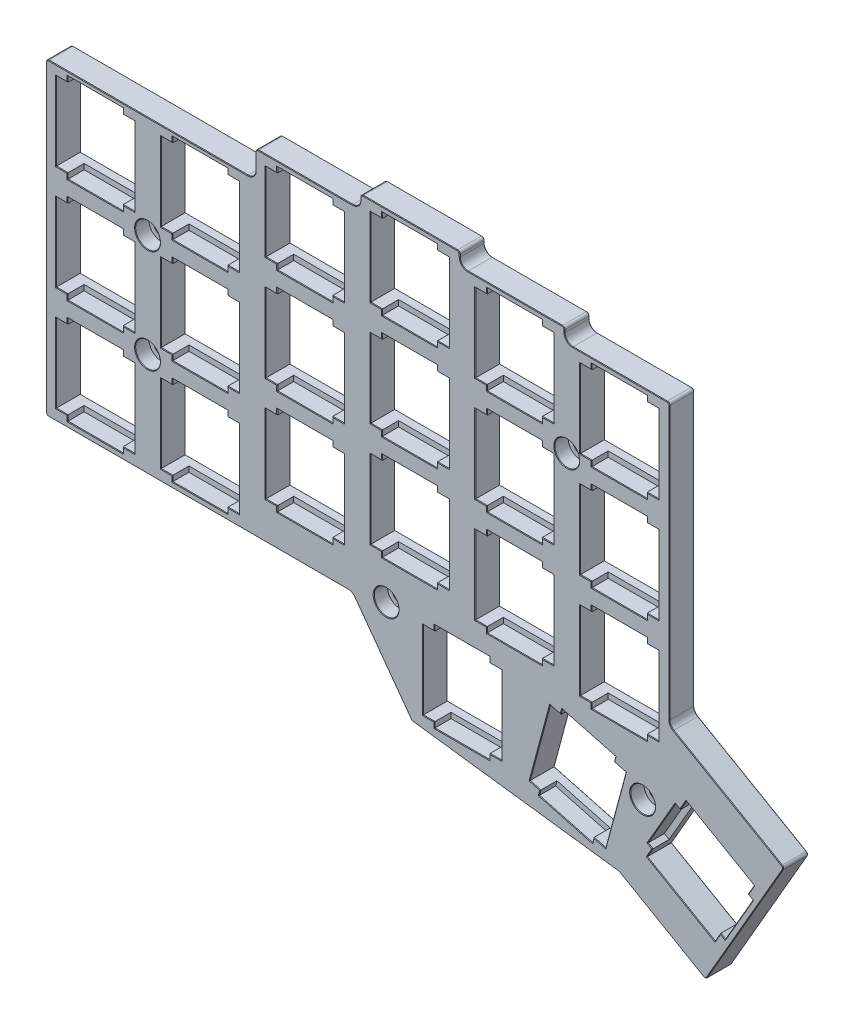
from build123d import *

# Parameters (mm, degrees)
SKETCH2_R           = 1.375
BOSS_EXTRUDE1_DEPTH = 4.5
SKETCH3_R           = 2.25
CUT_EXTRUDE1_DEPTH  = 2.5
SKETCH2_4_W         = 10
SKETCH2_4_H         = 1
BOSS_EXTRUDE2_DEPTH = 1.5
CHAMFER1_SIZE       = 0.1


with BuildPart() as part:
    # Sketch2 → Boss-Extrude1 (new body)
    with BuildSketch(Plane.XY):
        with BuildLine():
            ThreePointArc((40.99248066, 92.247445278), (40.564234363, 91.213567258), (39.530356344, 90.785320961))
            Line((39.530356344, 90.785320961), (3.456164679, 90.785320961))
            ThreePointArc((3.456164679, 90.785320961), (3.129393441, 90.649967882), (2.994040363, 90.323196644))
            Line((2.994040363, 90.323196644), (2.994040363, 35.296142343))
            ThreePointArc((2.994040363, 35.296142343), (3.129393441, 34.969371105), (3.456164679, 34.834018026))
            Line((3.456164679, 34.834018026), (57.719595004, 34.834018026))
            ThreePointArc((57.719595004, 34.834018026), (58.382224343, 34.675247029), (58.900944824, 34.233415689))
            Line((58.900944824, 34.233415689), (69.174535582, 20.145899766))
            ThreePointArc((69.174535582, 20.145899766), (69.312297099, 20.020650552), (69.488305284, 19.959932185))
            Line((69.488305284, 19.959932185), (106.584056872, 15.134426783))
            ThreePointArc((106.584056872, 15.134426783), (106.86436497, 15.069410172), (107.126511412, 14.950755076))
            Line((107.126511412, 14.950755076), (122.178649221, 6.26039926))
            ThreePointArc((122.178649221, 6.26039926), (122.529317954, 6.214232846), (122.809922777, 6.4295485))
            Line((122.809922777, 6.4295485), (136.547798459, 30.224247168))
            ThreePointArc((136.547798459, 30.224247168), (136.593964874, 30.574915901), (136.37864922, 30.855520725))
            Line((136.37864922, 30.855520725), (116.728462948, 42.200561058))
            ThreePointArc((116.728462948, 42.200561058), (116.193288305, 42.735735701), (115.99740079, 43.466797859))
            Line((115.99740079, 43.466797859), (115.99740079, 92.828345033))
            ThreePointArc((115.99740079, 92.828345033), (115.862047712, 93.155116271), (115.535276474, 93.290469349))
            Line((115.535276474, 93.290469349), (98.457766482, 93.290469349))
            ThreePointArc((98.457766482, 93.290469349), (97.423888462, 93.718715647), (96.995642165, 94.752593666))
            Line((96.995642165, 94.752593666), (96.995642165, 95.213192117))
            ThreePointArc((96.995642165, 95.213192117), (96.860289087, 95.539963355), (96.533517849, 95.675316434))
            Line((96.533517849, 95.675316434), (79.456541469, 95.675316434))
            ThreePointArc((79.456541469, 95.675316434), (78.42266345, 96.103562731), (77.994417152, 97.137440751))
            Line((77.994417152, 97.137440751), (77.994417152, 97.587767164))
            ThreePointArc((77.994417152, 97.587767164), (77.859064074, 97.914538402), (77.532292836, 98.049891481))
            Line((77.532292836, 98.049891481), (60.456541472, 98.049891481))
            ThreePointArc((60.456541472, 98.049891481), (60.129770234, 97.914538402), (59.994417156, 97.587767164))
            Line((59.994417156, 97.587767164), (59.994417156, 97.133171852))
            ThreePointArc((59.994417156, 97.133171852), (59.566170859, 96.099293832), (58.532292839, 95.671047535))
            Line((58.532292839, 95.671047535), (41.454604977, 95.671047535))
            ThreePointArc((41.454604977, 95.671047535), (41.127833739, 95.535694456), (40.99248066, 95.208923218))
            Line((40.99248066, 95.208923218), (40.99248066, 92.247445278))
        make_face()
        Polygon((6.896591633, 51.025568854), (6.896591633, 52.025568854), (16.896591633, 52.025568854), (16.896591633, 51.025568854), (18.996591632, 51.025568854), (18.996591632, 36.825568858), (16.896591633, 36.825568858), (16.896591633, 35.825568858), (6.896591633, 35.825568858), (6.896591633, 36.825568858), (4.796591635, 36.825568858), (4.796591635, 51.025568854), align=None, mode=Mode.SUBTRACT)
        Polygon((25.894762974, 51.026240306), (25.894762974, 52.026240306), (35.894762974, 52.026240306), (35.894762974, 51.026240306), (37.994762972, 51.026240306), (37.994762972, 36.82624031), (35.894762974, 36.82624031), (35.894762974, 35.82624031), (25.894762974, 35.82624031), (25.894762974, 36.82624031), (23.794762976, 36.82624031), (23.794762976, 51.026240306), align=None, mode=Mode.SUBTRACT)
        with Locations((64.637863533, 36.300090173)):
            Circle(SKETCH2_R, mode=Mode.SUBTRACT)
        Polygon((54.895031931, 40.571054802), (44.895031931, 40.571054802), (44.895031931, 41.571054802), (42.795031933, 41.571054802), (42.795031933, 55.771054799), (44.895031931, 55.771054799), (44.895031931, 56.771054799), (54.895031931, 56.771054799), (54.895031931, 55.771054799), (56.995031929, 55.771054799), (56.995031929, 41.571054802), (54.895031931, 41.571054802), align=None, mode=Mode.SUBTRACT)
        Polygon((63.896968427, 58.149898744), (63.896968427, 59.149898744), (73.896968427, 59.149898744), (73.896968427, 58.149898744), (75.996968425, 58.149898744), (75.996968425, 43.949898748), (73.896968427, 43.949898748), (73.896968427, 42.949898748), (63.896968427, 42.949898748), (63.896968427, 43.949898748), (61.796968429, 43.949898748), (61.796968429, 58.149898744), align=None, mode=Mode.SUBTRACT)
        Polygon((73.416585941, 36.11741384), (73.416585941, 37.11741384), (83.416585941, 37.11741384), (83.416585941, 36.11741384), (85.516585939, 36.11741384), (85.516585939, 21.917413844), (83.416585941, 21.917413844), (83.416585941, 20.917413844), (73.416585941, 20.917413844), (73.416585941, 21.917413844), (71.316585943, 21.917413844), (71.316585943, 36.11741384), align=None, mode=Mode.SUBTRACT)
        Polygon((96.549397792, 35.451212839), (106.208656055, 32.863022388), (105.94983701, 31.897096562), (108.074873824, 31.327694664), (104.399643385, 17.611547934), (102.27460657, 18.180949832), (102.015787525, 17.215024006), (92.356529262, 19.803214457), (92.615348307, 20.769140283), (90.683496655, 21.286778373), (94.358727094, 35.002925103), (96.290578747, 34.485287013), align=None, mode=Mode.SUBTRACT)
        with Locations((111.137845658, 28.550051811)):
            Circle(SKETCH2_R, mode=Mode.SUBTRACT)
        Polygon((112.07237749, 22.200360653), (117.07237749, 30.860614691), (117.938402894, 30.360614691), (119.038402892, 32.265870576), (131.335963623, 25.165870578), (130.235963625, 23.260614693), (131.101989028, 22.760614693), (126.101989028, 14.100360655), (125.235963625, 14.600360655), (124.235963625, 12.868309848), (111.938402894, 19.968309846), (112.938402894, 21.700360653), align=None, mode=Mode.SUBTRACT)
        Polygon((92.898193439, 40.575323701), (82.898193439, 40.575323701), (82.898193439, 41.575323701), (80.798193441, 41.575323701), (80.798193441, 55.775323698), (82.898193439, 55.775323698), (82.898193439, 56.775323698), (92.898193439, 56.775323698), (92.898193439, 55.775323698), (94.998193438, 55.775323698), (94.998193438, 41.575323701), (92.898193439, 41.575323701), align=None, mode=Mode.SUBTRACT)
        Polygon((101.899952065, 53.390476613), (101.899952065, 54.390476613), (111.899952065, 54.390476613), (111.899952065, 53.390476613), (113.999952063, 53.390476613), (113.999952063, 39.190476616), (111.899952065, 39.190476616), (111.899952065, 38.190476616), (101.899952065, 38.190476616), (101.899952065, 39.190476616), (99.799952066, 39.190476616), (99.799952066, 53.390476613), align=None, mode=Mode.SUBTRACT)
        Polygon((6.896591633, 70.025568849), (6.896591633, 71.025568849), (16.896591633, 71.025568849), (16.896591633, 70.025568849), (18.996591632, 70.025568849), (18.996591632, 55.825568853), (16.896591633, 55.825568853), (16.896591633, 54.825568853), (6.896591633, 54.825568853), (6.896591633, 55.825568853), (4.796591635, 55.825568853), (4.796591635, 70.025568849), align=None, mode=Mode.SUBTRACT)
        with Locations((21.387798276, 53.550235091)):
            Circle(SKETCH2_R, mode=Mode.SUBTRACT)
        Polygon((25.894762974, 70.026240301), (25.894762974, 71.026240301), (35.894762974, 71.026240301), (35.894762974, 70.026240301), (37.994762972, 70.026240301), (37.994762972, 55.826240305), (35.894762974, 55.826240305), (35.894762974, 54.826240305), (25.894762974, 54.826240305), (25.894762974, 55.826240305), (23.794762976, 55.826240305), (23.794762976, 70.026240301), align=None, mode=Mode.SUBTRACT)
        with Locations((21.387798276, 72.300241098)):
            Circle(SKETCH2_R, mode=Mode.SUBTRACT)
        Polygon((54.895031931, 59.571054797), (44.895031931, 59.571054797), (44.895031931, 60.571054797), (42.795031933, 60.571054797), (42.795031933, 74.771054794), (44.895031931, 74.771054794), (44.895031931, 75.771054794), (54.895031931, 75.771054794), (54.895031931, 74.771054794), (56.995031929, 74.771054794), (56.995031929, 60.571054797), (54.895031931, 60.571054797), align=None, mode=Mode.SUBTRACT)
        Polygon((63.896968427, 77.149898739), (63.896968427, 78.149898739), (73.896968427, 78.149898739), (73.896968427, 77.149898739), (75.996968425, 77.149898739), (75.996968425, 62.949898743), (73.896968427, 62.949898743), (73.896968427, 61.949898743), (63.896968427, 61.949898743), (63.896968427, 62.949898743), (61.796968429, 62.949898743), (61.796968429, 77.149898739), align=None, mode=Mode.SUBTRACT)
        Polygon((6.896591633, 89.02556159), (6.896591633, 90.02556159), (16.896591633, 90.02556159), (16.896591633, 89.02556159), (18.996591632, 89.02556159), (18.996591632, 74.825561594), (16.896591633, 74.825561594), (16.896591633, 73.825561594), (6.896591633, 73.825561594), (6.896591633, 74.825561594), (4.796591635, 74.825561594), (4.796591635, 89.02556159), align=None, mode=Mode.SUBTRACT)
        Polygon((25.894762974, 89.026233042), (25.894762974, 90.026233042), (35.894762974, 90.026233042), (35.894762974, 89.026233042), (37.994762972, 89.026233042), (37.994762972, 74.826233046), (35.894762974, 74.826233046), (35.894762974, 73.826233046), (25.894762974, 73.826233046), (25.894762974, 74.826233046), (23.794762976, 74.826233046), (23.794762976, 89.026233042), align=None, mode=Mode.SUBTRACT)
        Polygon((42.795031933, 79.571047539), (42.795031933, 93.771047535), (44.895031931, 93.771047535), (44.895031931, 94.771047535), (54.895031931, 94.771047535), (54.895031931, 93.771047535), (56.995031929, 93.771047535), (56.995031929, 79.571047539), (54.895031931, 79.571047539), (54.895031931, 78.571047539), (44.895031931, 78.571047539), (44.895031931, 79.571047539), align=None, mode=Mode.SUBTRACT)
        Polygon((63.896968427, 81.949891484), (61.796968429, 81.949891484), (61.796968429, 96.14989148), (63.896968427, 96.14989148), (63.896968427, 97.14989148), (73.896968427, 97.14989148), (73.896968427, 96.14989148), (75.996968425, 96.14989148), (75.996968425, 81.949891484), (73.896968427, 81.949891484), (73.896968427, 80.949891484), (63.896968427, 80.949891484), align=None, mode=Mode.SUBTRACT)
        Polygon((80.798193441, 60.575323696), (80.798193441, 74.775323693), (82.898193439, 74.775323693), (82.898193439, 75.775323693), (92.898193439, 75.775323693), (92.898193439, 74.775323693), (94.998193438, 74.775323693), (94.998193438, 60.575323696), (92.898193439, 60.575323696), (92.898193439, 59.575323696), (82.898193439, 59.575323696), (82.898193439, 60.575323696), align=None, mode=Mode.SUBTRACT)
        Polygon((99.799952066, 58.190476612), (99.799952066, 72.390476608), (101.899952065, 72.390476608), (101.899952065, 73.390476608), (111.899952065, 73.390476608), (111.899952065, 72.390476608), (113.999952063, 72.390476608), (113.999952063, 58.190476612), (111.899952065, 58.190476612), (111.899952065, 57.190476612), (101.899952065, 57.190476612), (101.899952065, 58.190476612), align=None, mode=Mode.SUBTRACT)
        with Locations((97.387827206, 76.050038887)):
            Circle(SKETCH2_R, mode=Mode.SUBTRACT)
        Polygon((82.898193439, 79.575316437), (80.798193441, 79.575316437), (80.798193441, 93.775316434), (82.898193439, 93.775316434), (82.898193439, 94.775316434), (92.898193439, 94.775316434), (92.898193439, 93.775316434), (94.998193438, 93.775316434), (94.998193438, 79.575316437), (92.898193439, 79.575316437), (92.898193439, 78.575316437), (82.898193439, 78.575316437), align=None, mode=Mode.SUBTRACT)
        Polygon((101.899952065, 77.190469353), (99.799952066, 77.190469353), (99.799952066, 91.390469349), (101.899952065, 91.390469349), (101.899952065, 92.390469349), (111.899952065, 92.390469349), (111.899952065, 91.390469349), (113.999952063, 91.390469349), (113.999952063, 77.190469353), (111.899952065, 77.190469353), (111.899952065, 76.190469353), (101.899952065, 76.190469353), align=None, mode=Mode.SUBTRACT)
    extrude(amount=BOSS_EXTRUDE1_DEPTH)

    # Sketch3 → Cut-Extrude1 (cut)
    with BuildSketch(Plane.XY.offset(4.5)):
        with Locations((21.387798276, 72.300241098)):
            Circle(SKETCH3_R)
        with Locations((21.387798276, 53.550235091)):
            Circle(SKETCH3_R)
        with Locations((64.637863533, 36.300090173)):
            Circle(SKETCH3_R)
        with Locations((111.137845658, 28.550051811)):
            Circle(SKETCH3_R)
        with Locations((97.387827206, 76.050038887)):
            Circle(SKETCH3_R)
    extrude(amount=-CUT_EXTRUDE1_DEPTH, mode=Mode.SUBTRACT)

    # Sketch2<4> → Boss-Extrude2 (add)
    with BuildSketch(Plane.XY):
        Polygon((105.94983701, 31.897096562), (106.208656055, 32.863022388), (96.549397792, 35.451212839), (96.290578747, 34.485287013), align=None)
        Polygon((102.015787525, 17.215024006), (102.27460657, 18.180949832), (92.615348307, 20.769140283), (92.356529262, 19.803214457), align=None)
        with Locations((11.896591633, 89.52556159)):
            Rectangle(SKETCH2_4_W, SKETCH2_4_H)
        with Locations((11.896591633, 74.325561594)):
            Rectangle(SKETCH2_4_W, SKETCH2_4_H)
        with Locations((11.896591633, 70.525568849)):
            Rectangle(SKETCH2_4_W, SKETCH2_4_H)
        with Locations((11.896591633, 55.325568853)):
            Rectangle(SKETCH2_4_W, SKETCH2_4_H)
        with Locations((11.896591633, 51.525568854)):
            Rectangle(SKETCH2_4_W, SKETCH2_4_H)
        with Locations((11.896591633, 36.325568858)):
            Rectangle(SKETCH2_4_W, SKETCH2_4_H)
        with Locations((30.894762974, 89.526233042)):
            Rectangle(SKETCH2_4_W, SKETCH2_4_H)
        with Locations((30.894762974, 74.326233046)):
            Rectangle(SKETCH2_4_W, SKETCH2_4_H)
        with Locations((30.894762974, 70.526240301)):
            Rectangle(SKETCH2_4_W, SKETCH2_4_H)
        with Locations((30.894762974, 55.326240305)):
            Rectangle(SKETCH2_4_W, SKETCH2_4_H)
        with Locations((30.894762974, 51.526240306)):
            Rectangle(SKETCH2_4_W, SKETCH2_4_H)
        with Locations((30.894762974, 36.32624031)):
            Rectangle(SKETCH2_4_W, SKETCH2_4_H)
        with Locations((49.895031931, 41.071054802)):
            Rectangle(SKETCH2_4_W, SKETCH2_4_H)
        with Locations((49.895031931, 56.271054799)):
            Rectangle(SKETCH2_4_W, SKETCH2_4_H)
        with Locations((49.895031931, 60.071054797)):
            Rectangle(SKETCH2_4_W, SKETCH2_4_H)
        with Locations((49.895031931, 75.271054794)):
            Rectangle(SKETCH2_4_W, SKETCH2_4_H)
        with Locations((49.895031931, 94.271047535)):
            Rectangle(SKETCH2_4_W, SKETCH2_4_H)
        with Locations((49.895031931, 79.071047539)):
            Rectangle(SKETCH2_4_W, SKETCH2_4_H)
        with Locations((68.896968427, 81.449891484)):
            Rectangle(SKETCH2_4_W, SKETCH2_4_H)
        with Locations((68.896968427, 96.64989148)):
            Rectangle(SKETCH2_4_W, SKETCH2_4_H)
        with Locations((87.898193439, 79.075316437)):
            Rectangle(SKETCH2_4_W, SKETCH2_4_H)
        with Locations((87.898193439, 94.275316434)):
            Rectangle(SKETCH2_4_W, SKETCH2_4_H)
        with Locations((68.896968427, 77.649898739)):
            Rectangle(SKETCH2_4_W, SKETCH2_4_H)
        with Locations((68.896968427, 62.449898743)):
            Rectangle(SKETCH2_4_W, SKETCH2_4_H)
        with Locations((106.899952065, 76.690469353)):
            Rectangle(SKETCH2_4_W, SKETCH2_4_H)
        with Locations((106.899952065, 91.890469349)):
            Rectangle(SKETCH2_4_W, SKETCH2_4_H)
        with Locations((68.896968427, 58.649898744)):
            Rectangle(SKETCH2_4_W, SKETCH2_4_H)
        with Locations((68.896968427, 43.449898748)):
            Rectangle(SKETCH2_4_W, SKETCH2_4_H)
        with Locations((106.899952065, 72.890476608)):
            Rectangle(SKETCH2_4_W, SKETCH2_4_H)
        with Locations((106.899952065, 57.690476612)):
            Rectangle(SKETCH2_4_W, SKETCH2_4_H)
        with Locations((87.898193439, 41.075323701)):
            Rectangle(SKETCH2_4_W, SKETCH2_4_H)
        with Locations((87.898193439, 56.275323698)):
            Rectangle(SKETCH2_4_W, SKETCH2_4_H)
        with Locations((87.898193439, 75.275323693)):
            Rectangle(SKETCH2_4_W, SKETCH2_4_H)
        with Locations((87.898193439, 60.075323696)):
            Rectangle(SKETCH2_4_W, SKETCH2_4_H)
        with Locations((106.899952065, 53.890476613)):
            Rectangle(SKETCH2_4_W, SKETCH2_4_H)
        with Locations((106.899952065, 38.690476616)):
            Rectangle(SKETCH2_4_W, SKETCH2_4_H)
        with Locations((78.416585941, 36.61741384)):
            Rectangle(SKETCH2_4_W, SKETCH2_4_H)
        with Locations((78.416585941, 21.417413844)):
            Rectangle(SKETCH2_4_W, SKETCH2_4_H)
        Polygon((117.938402894, 30.360614691), (117.07237749, 30.860614691), (112.07237749, 22.200360653), (112.938402894, 21.700360653), align=None)
        Polygon((131.101989028, 22.760614693), (130.235963625, 23.260614693), (125.235963625, 14.600360655), (126.101989028, 14.100360655), align=None)
    extrude(amount=BOSS_EXTRUDE2_DEPTH)

    # Chamfer1
    chamfer1_edges = [part.edges().sort_by_distance(p)[0] for p in [
        (72.366585942, 36.11741384, 4.5),
        (73.416585941, 36.61741384, 4.5),
        (78.416585941, 37.11741384, 4.5),
        (83.416585941, 36.61741384, 4.5),
        (84.46658594, 36.11741384, 4.5),
        (92.521111874, 28.144851738, 4.5),
        (95.324652921, 34.744106058, 4.5),
        (96.419988269, 34.968249926, 4.5),
        (101.379026923, 34.157117614, 4.5),
        (112.949952064, 77.190469353, 4.5),
        (106.079246532, 32.380059475, 4.5),
        (107.012355417, 31.612395613, 4.5),
        (106.237258604, 24.469621299, 4.5),
        (103.337124977, 17.896248883, 4.5),
        (102.145197048, 17.697986919, 4.5),
        (97.186158394, 18.509119231, 4.5),
        (92.485938785, 20.28617737, 4.5),
        (91.649422481, 21.027959328, 4.5),
        (118.488402893, 31.313242634, 4.5),
        (125.187183258, 28.715870577, 4.5),
        (130.785963624, 24.213242636, 4.5),
        (130.668976327, 23.010614693, 4.5),
        (111.899952065, 76.690469353, 4.5),
        (128.601989028, 18.430487674, 4.5),
        (125.668976327, 14.350360655, 4.5),
        (124.735963625, 13.734335251, 4.5),
        (118.087183259, 16.418309847, 4.5),
        (112.438402894, 20.83433525, 4.5),
        (112.505390192, 21.950360653, 4.5),
        (114.57237749, 26.530487672, 4.5),
        (106.899952065, 76.190469353, 4.5),
        (117.505390192, 30.610614691, 4.5),
        (40.99248066, 93.728184248, 4.5),
        (40.564234363, 91.213567258, 4.5),
        (21.493260511, 90.785320961, 4.5),
        (3.129393441, 90.649967882, 4.5),
        (2.994040363, 62.809669494, 4.5),
        (101.899952065, 76.690469353, 4.5),
        (3.129393441, 34.969371105, 4.5),
        (30.587879841, 34.834018026, 4.5),
        (58.382224343, 34.675247029, 4.5),
        (64.037740203, 27.189657727, 4.5),
        (69.312297099, 20.020650552, 4.5),
        (88.036181078, 17.547179484, 4.5),
        (106.86436497, 15.069410172, 4.5),
        (114.652580317, 10.605577168, 4.5),
        (122.529317954, 6.214232846, 4.5),
        (129.678860618, 18.326897834, 4.5),
        (100.849952065, 77.190469353, 4.5),
        (136.593964874, 30.574915901, 4.5),
        (126.553556084, 36.528040891, 4.5),
        (116.193288305, 42.735735701, 4.5),
        (115.99740079, 68.147571446, 4.5),
        (115.862047712, 93.155116271, 4.5),
        (106.996521478, 93.290469349, 4.5),
        (99.799952066, 84.290469351, 4.5),
        (97.423888462, 93.718715647, 4.5),
        (96.995642165, 94.982892892, 4.5),
        (96.860289087, 95.539963355, 4.5),
        (87.995029659, 95.675316434, 4.5),
        (78.42266345, 96.103562731, 4.5),
        (77.994417152, 97.362603957, 4.5),
        (77.859064074, 97.914538402, 4.5),
        (68.994417154, 98.049891481, 4.5),
        (60.129770234, 97.914538402, 4.5),
        (59.994417156, 97.360469508, 4.5),
        (100.849952065, 91.390469349, 4.5),
        (59.566170859, 96.099293832, 4.5),
        (49.993448908, 95.671047535, 4.5),
        (41.127833739, 95.535694456, 4.5),
        (101.899952065, 91.890469349, 4.5),
        (68.896968427, 97.14989148, 4.5),
        (73.896968427, 96.64989148, 4.5),
        (74.946968426, 96.14989148, 4.5),
        (75.996968425, 89.049891482, 4.5),
        (74.946968426, 81.949891484, 4.5),
        (73.896968427, 81.449891484, 4.5),
        (68.896968427, 80.949891484, 4.5),
        (63.896968427, 81.449891484, 4.5),
        (62.846968428, 81.949891484, 4.5),
        (61.796968429, 89.049891482, 4.5),
        (62.846968428, 96.14989148, 4.5),
        (63.896968427, 96.64989148, 4.5),
        (4.796591635, 81.925561592, 4.5),
        (5.846591634, 89.02556159, 4.5),
        (6.896591633, 89.52556159, 4.5),
        (11.896591633, 90.02556159, 4.5),
        (16.896591633, 89.52556159, 4.5),
        (17.946591633, 89.02556159, 4.5),
        (18.996591632, 81.925561592, 4.5),
        (17.946591633, 74.825561594, 4.5),
        (16.896591633, 74.325561594, 4.5),
        (11.896591633, 73.825561594, 4.5),
        (6.896591633, 74.325561594, 4.5),
        (5.846591634, 74.825561594, 4.5),
        (23.794762976, 81.926233044, 4.5),
        (24.844762975, 89.026233042, 4.5),
        (25.894762974, 89.526233042, 4.5),
        (30.894762974, 90.026233042, 4.5),
        (35.894762974, 89.526233042, 4.5),
        (36.944762973, 89.026233042, 4.5),
        (37.994762972, 81.926233044, 4.5),
        (36.944762973, 74.826233046, 4.5),
        (35.894762974, 74.326233046, 4.5),
        (30.894762974, 73.826233046, 4.5),
        (25.894762974, 74.326233046, 4.5),
        (41.127833739, 95.535694456, 0),
        (49.993448908, 95.671047535, 0),
        (59.566170859, 96.099293832, 0),
        (24.844762975, 74.826233046, 4.5),
        (59.994417156, 97.360469508, 0),
        (60.129770234, 97.914538402, 0),
        (68.994417154, 98.049891481, 0),
        (77.859064074, 97.914538402, 0),
        (77.994417152, 97.362603957, 0),
        (78.42266345, 96.103562731, 0),
        (17.946591633, 70.025568849, 4.5),
        (87.995029659, 95.675316434, 0),
        (96.860289087, 95.539963355, 0),
        (96.995642165, 94.982892892, 0),
        (97.423888462, 93.718715647, 0),
        (106.996521478, 93.290469349, 0),
        (115.862047712, 93.155116271, 0),
        (115.99740079, 68.147571446, 0),
        (116.193288305, 42.735735701, 0),
        (126.553556084, 36.528040891, 0),
        (136.593964874, 30.574915901, 0),
        (18.996591632, 62.925568851, 4.5),
        (129.678860618, 18.326897834, 0),
        (122.529317954, 6.214232846, 0),
        (114.652580317, 10.605577168, 0),
        (106.86436497, 15.069410172, 0),
        (88.036181078, 17.547179484, 0),
        (69.312297099, 20.020650552, 0),
        (64.037740203, 27.189657727, 0),
        (58.382224343, 34.675247029, 0),
        (30.587879841, 34.834018026, 0),
        (3.129393441, 34.969371105, 0),
        (17.946591633, 55.825568853, 4.5),
        (2.994040363, 62.809669494, 0),
        (3.129393441, 90.649967882, 0),
        (21.493260511, 90.785320961, 0),
        (40.564234363, 91.213567258, 0),
        (40.99248066, 93.728184248, 0),
        (96.012827206, 76.050038887, 0),
        (109.762845658, 28.550051811, 0),
        (63.262863533, 36.300090173, 0),
        (20.012798276, 53.550235091, 0),
        (20.012798276, 72.300241098, 0),
        (16.896591633, 55.325568853, 4.5),
        (115.488402893, 26.117090211, 0),
        (118.087183259, 16.418309847, 0),
        (127.785963624, 19.017090213, 0),
        (11.896591633, 54.825568853, 4.5),
        (125.187183258, 28.715870577, 0),
        (97.54157002, 19.449163153, 0),
        (106.237258604, 24.469621299, 0),
        (101.216800459, 33.165309883, 0),
        (6.896591633, 55.325568853, 4.5),
        (92.521111874, 28.144851738, 0),
        (78.416585941, 36.11741384, 0),
        (106.899952065, 73.390476608, 4.5),
        (71.316585943, 29.017413842, 0),
        (5.846591634, 55.825568853, 4.5),
        (78.416585941, 21.917413844, 0),
        (85.516585939, 29.017413842, 0),
        (4.796591635, 62.925568851, 4.5),
        (106.899952065, 53.390476613, 0),
        (99.799952066, 46.290476615, 0),
        (106.899952065, 39.190476616, 0),
        (5.846591634, 70.025568849, 4.5),
        (113.999952063, 46.290476615, 0),
        (87.898193439, 55.775323698, 0),
        (6.896591633, 70.525568849, 4.5),
        (80.798193441, 48.675323699, 0),
        (87.898193439, 41.575323701, 0),
        (11.896591633, 71.025568849, 4.5),
        (94.998193438, 48.675323699, 0),
        (68.896968427, 58.149898744, 0),
        (61.796968429, 51.049898746, 0),
        (68.896968427, 43.949898748, 0),
        (16.896591633, 70.525568849, 4.5),
        (75.996968425, 51.049898746, 0),
        (36.944762973, 70.026240301, 4.5),
        (49.895031931, 55.771054799, 0),
        (42.795031933, 48.6710548, 0),
        (49.895031931, 41.571054802, 0),
        (56.995031929, 48.6710548, 0),
        (37.994762972, 62.926240303, 4.5),
        (30.894762974, 51.026240306, 0),
        (23.794762976, 43.926240308, 0),
        (30.894762974, 36.82624031, 0),
        (36.944762973, 55.826240305, 4.5),
        (37.994762972, 43.926240308, 0),
        (11.896591633, 51.025568854, 0),
        (4.796591635, 43.925568856, 0),
        (11.896591633, 36.825568858, 0),
        (35.894762974, 55.326240305, 4.5),
        (18.996591632, 43.925568856, 0),
        (87.898193439, 79.575316437, 0),
        (94.998193438, 86.675316436, 0),
        (87.898193439, 93.775316434, 0),
        (30.894762974, 54.826240305, 4.5),
        (80.798193441, 86.675316436, 0),
        (49.895031931, 74.771054794, 0),
        (25.894762974, 55.326240305, 4.5),
        (42.795031933, 67.671054796, 0),
        (49.895031931, 60.571054797, 0),
        (111.899952065, 72.890476608, 4.5),
        (56.995031929, 67.671054796, 0),
        (87.898193439, 60.575323696, 0),
        (94.998193438, 67.675323695, 0),
        (24.844762975, 55.826240305, 4.5),
        (87.898193439, 74.775323693, 0),
        (80.798193441, 67.675323695, 0),
        (23.794762976, 62.926240303, 4.5),
        (68.896968427, 77.149898739, 0),
        (61.796968429, 70.049898741, 0),
        (68.896968427, 62.949898743, 0),
        (24.844762975, 70.026240301, 4.5),
        (75.996968425, 70.049898741, 0),
        (25.894762974, 70.526240301, 4.5),
        (49.895031931, 79.571047539, 0),
        (56.995031929, 86.671047537, 0),
        (49.895031931, 93.771047535, 0),
        (30.894762974, 71.026240301, 4.5),
        (42.795031933, 86.671047537, 0),
        (30.894762974, 70.026240301, 0),
        (35.894762974, 70.526240301, 4.5),
        (23.794762976, 62.926240303, 0),
        (30.894762974, 55.826240305, 0),
        (54.895031931, 79.071047539, 4.5),
        (37.994762972, 62.926240303, 0),
        (11.896591633, 70.025568849, 0),
        (4.796591635, 62.925568851, 0),
        (11.896591633, 55.825568853, 0),
        (49.895031931, 78.571047539, 4.5),
        (18.996591632, 62.925568851, 0),
        (30.894762974, 74.826233046, 0),
        (37.994762972, 81.926233044, 0),
        (44.895031931, 79.071047539, 4.5),
        (30.894762974, 89.026233042, 0),
        (23.794762976, 81.926233044, 0),
        (11.896591633, 74.825561594, 0),
        (43.845031932, 79.571047539, 4.5),
        (18.996591632, 81.925561592, 0),
        (11.896591633, 89.02556159, 0),
        (4.796591635, 81.925561592, 0),
        (68.896968427, 96.14989148, 0),
        (42.795031933, 86.671047537, 4.5),
        (61.796968429, 89.049891482, 0),
        (68.896968427, 81.949891484, 0),
        (75.996968425, 89.049891482, 0),
        (112.949952064, 72.390476608, 4.5),
        (43.845031932, 93.771047535, 4.5),
        (106.899952065, 91.390469349, 0),
        (99.799952066, 84.290469351, 0),
        (106.899952065, 77.190469353, 0),
        (113.999952063, 84.290469351, 0),
        (44.895031931, 94.271047535, 4.5),
        (106.899952065, 72.390476608, 0),
        (99.799952066, 65.29047661, 0),
        (106.899952065, 58.190476612, 0),
        (49.895031931, 94.771047535, 4.5),
        (113.999952063, 65.29047661, 0),
        (54.895031931, 94.271047535, 4.5),
        (55.94503193, 93.771047535, 4.5),
        (56.995031929, 86.671047537, 4.5),
        (55.94503193, 79.571047539, 4.5),
        (74.946968426, 77.149898739, 4.5),
        (75.996968425, 70.049898741, 4.5),
        (74.946968426, 62.949898743, 4.5),
        (73.896968427, 62.449898743, 4.5),
        (68.896968427, 61.949898743, 4.5),
        (113.999952063, 65.29047661, 4.5),
        (63.896968427, 62.449898743, 4.5),
        (62.846968428, 62.949898743, 4.5),
        (61.796968429, 70.049898741, 4.5),
        (62.846968428, 77.149898739, 4.5),
        (63.896968427, 77.649898739, 4.5),
        (68.896968427, 78.149898739, 4.5),
        (73.896968427, 77.649898739, 4.5),
        (92.898193439, 60.075323696, 4.5),
        (87.898193439, 59.575323696, 4.5),
        (82.898193439, 60.075323696, 4.5),
        (81.84819344, 60.575323696, 4.5),
        (112.949952064, 58.190476612, 4.5),
        (80.798193441, 67.675323695, 4.5),
        (81.84819344, 74.775323693, 4.5),
        (82.898193439, 75.275323693, 4.5),
        (87.898193439, 75.775323693, 4.5),
        (92.898193439, 75.275323693, 4.5),
        (93.948193439, 74.775323693, 4.5),
        (94.998193438, 67.675323695, 4.5),
        (93.948193439, 60.575323696, 4.5),
        (55.94503193, 74.771054794, 4.5),
        (56.995031929, 67.671054796, 4.5),
        (55.94503193, 60.571054797, 4.5),
        (54.895031931, 60.071054797, 4.5),
        (111.899952065, 57.690476612, 4.5),
        (49.895031931, 59.571054797, 4.5),
        (44.895031931, 60.071054797, 4.5),
        (43.845031932, 60.571054797, 4.5),
        (42.795031933, 67.671054796, 4.5),
        (43.845031932, 74.771054794, 4.5),
        (44.895031931, 75.271054794, 4.5),
        (49.895031931, 75.771054794, 4.5),
        (106.899952065, 57.190476612, 4.5),
        (54.895031931, 75.271054794, 4.5),
        (92.898193439, 79.075316437, 4.5),
        (87.898193439, 78.575316437, 4.5),
        (82.898193439, 79.075316437, 4.5),
        (81.84819344, 79.575316437, 4.5),
        (80.798193441, 86.675316436, 4.5),
        (81.84819344, 93.775316434, 4.5),
        (82.898193439, 94.275316434, 4.5),
        (87.898193439, 94.775316434, 4.5),
        (92.898193439, 94.275316434, 4.5),
        (93.948193439, 93.775316434, 4.5),
        (94.998193438, 86.675316436, 4.5),
        (101.899952065, 57.690476612, 4.5),
        (93.948193439, 79.575316437, 4.5),
        (18.996591632, 43.925568856, 4.5),
        (17.946591633, 36.825568858, 4.5),
        (16.896591633, 36.325568858, 4.5),
        (11.896591633, 35.825568858, 4.5),
        (6.896591633, 36.325568858, 4.5),
        (5.846591634, 36.825568858, 4.5),
        (4.796591635, 43.925568856, 4.5),
        (5.846591634, 51.025568854, 4.5),
        (6.896591633, 51.525568854, 4.5),
        (11.896591633, 52.025568854, 4.5),
        (100.849952065, 58.190476612, 4.5),
        (16.896591633, 51.525568854, 4.5),
        (17.946591633, 51.025568854, 4.5),
        (36.944762973, 51.026240306, 4.5),
        (37.994762972, 43.926240308, 4.5),
        (36.944762973, 36.82624031, 4.5),
        (35.894762974, 36.32624031, 4.5),
        (30.894762974, 35.82624031, 4.5),
        (99.799952066, 65.29047661, 4.5),
        (25.894762974, 36.32624031, 4.5),
        (24.844762975, 36.82624031, 4.5),
        (23.794762976, 43.926240308, 4.5),
        (24.844762975, 51.026240306, 4.5),
        (25.894762974, 51.526240306, 4.5),
        (30.894762974, 52.026240306, 4.5),
        (35.894762974, 51.526240306, 4.5),
        (55.94503193, 55.771054799, 4.5),
        (56.995031929, 48.6710548, 4.5),
        (55.94503193, 41.571054802, 4.5),
        (54.895031931, 41.071054802, 4.5),
        (100.849952065, 72.390476608, 4.5),
        (49.895031931, 40.571054802, 4.5),
        (44.895031931, 41.071054802, 4.5),
        (43.845031932, 41.571054802, 4.5),
        (42.795031933, 48.6710548, 4.5),
        (43.845031932, 55.771054799, 4.5),
        (44.895031931, 56.271054799, 4.5),
        (95.137827206, 76.050038887, 4.5),
        (49.895031931, 56.771054799, 4.5),
        (108.887845658, 28.550051811, 4.5),
        (62.387863533, 36.300090173, 4.5),
        (54.895031931, 56.271054799, 4.5),
        (101.899952065, 72.890476608, 4.5),
        (19.137798276, 53.550235091, 4.5),
        (74.946968426, 58.149898744, 4.5),
        (19.137798276, 72.300241098, 4.5),
        (75.996968425, 51.049898746, 4.5),
        (74.946968426, 43.949898748, 4.5),
        (73.896968427, 43.449898748, 4.5),
        (68.896968427, 42.949898748, 4.5),
        (63.896968427, 43.449898748, 4.5),
        (106.899952065, 92.390469349, 4.5),
        (62.846968428, 43.949898748, 4.5),
        (61.796968429, 51.049898746, 4.5),
        (62.846968428, 58.149898744, 4.5),
        (63.896968427, 58.649898744, 4.5),
        (68.896968427, 59.149898744, 4.5),
        (73.896968427, 58.649898744, 4.5),
        (93.948193439, 55.775323698, 4.5),
        (94.998193438, 48.675323699, 4.5),
        (93.948193439, 41.575323701, 4.5),
        (92.898193439, 41.075323701, 4.5),
        (87.898193439, 40.575323701, 4.5),
        (82.898193439, 41.075323701, 4.5),
        (111.899952065, 91.890469349, 4.5),
        (81.84819344, 41.575323701, 4.5),
        (80.798193441, 48.675323699, 4.5),
        (81.84819344, 55.775323698, 4.5),
        (82.898193439, 56.275323698, 4.5),
        (87.898193439, 56.775323698, 4.5),
        (92.898193439, 56.275323698, 4.5),
        (112.949952064, 53.390476613, 4.5),
        (113.999952063, 46.290476615, 4.5),
        (112.949952064, 39.190476616, 4.5),
        (111.899952065, 38.690476616, 4.5),
        (106.899952065, 38.190476616, 4.5),
        (112.949952064, 91.390469349, 4.5),
        (101.899952065, 38.690476616, 4.5),
        (100.849952065, 39.190476616, 4.5),
        (99.799952066, 46.290476615, 4.5),
        (100.849952065, 53.390476613, 4.5),
        (101.899952065, 53.890476613, 4.5),
        (106.899952065, 54.390476613, 4.5),
        (111.899952065, 53.890476613, 4.5),
        (85.516585939, 29.017413842, 4.5),
        (84.46658594, 21.917413844, 4.5),
        (83.416585941, 21.417413844, 4.5),
        (78.416585941, 20.917413844, 4.5),
        (73.416585941, 21.417413844, 4.5),
        (113.999952063, 84.290469351, 4.5),
        (72.366585942, 21.917413844, 4.5),
        (71.316585943, 29.017413842, 4.5),
    ]]
    chamfer(chamfer1_edges, length=CHAMFER1_SIZE)


solid = part.part
